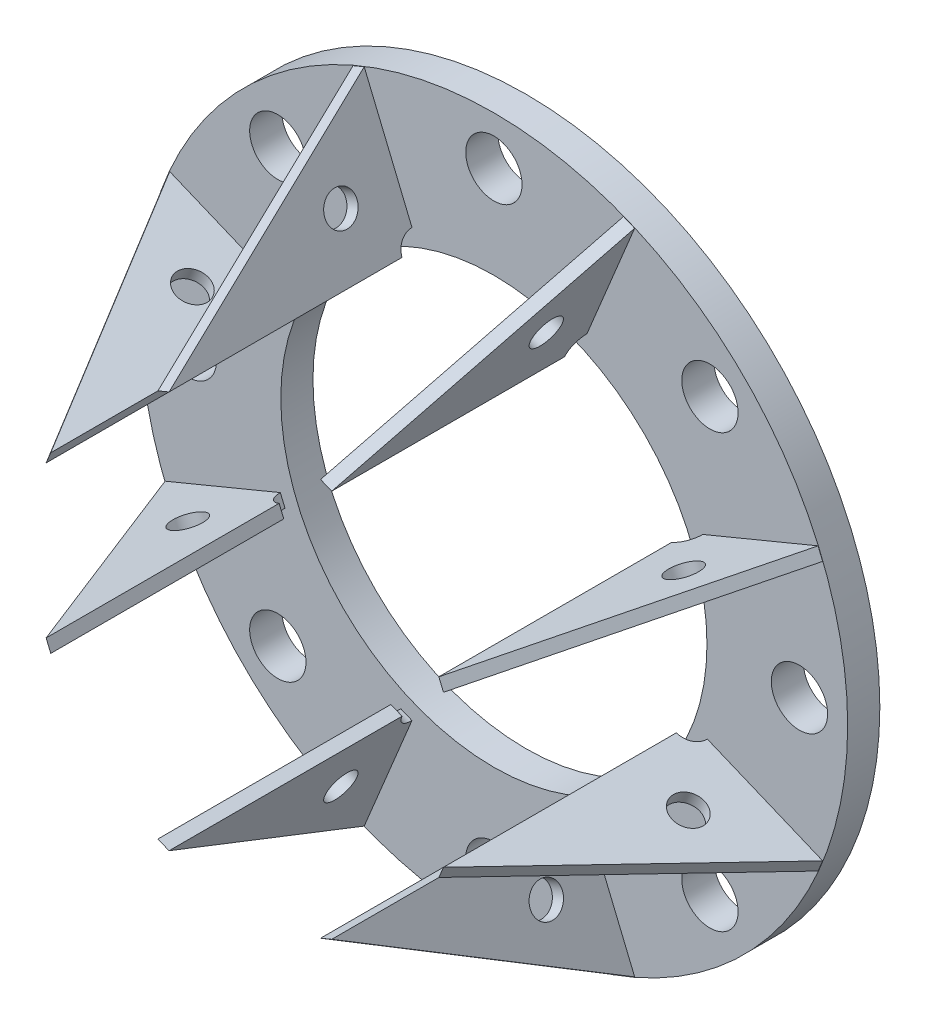
from build123d import *

# Parameters (mm, degrees)
SKETCH1_R         = 139.7
SKETCH1_R_2       = 84.1375
EXTRUDE1_DEPTH    = 12.7
CIRPATTERN2_COUNT = 8
EXTRUDE4_DEPTH    = 98.345625
EXTRUDE5_REACH    = 230.557
SKETCH8_R         = 6.35
CIRPATTERN4_COUNT = 8


with BuildPart() as part:
    # Sketch1 → Extrude1 (new body)
    with BuildSketch(Plane.XY):
        Circle(SKETCH1_R)
        Circle(SKETCH1_R_2, mode=Mode.SUBTRACT)
    extrude(amount=EXTRUDE1_DEPTH)

    # Sketch2 → 0.625_ Diameter Hole1 (revolve, cut)
    with BuildSketch(Plane(origin=(0, 120.65, 12.7), x_dir=(0, -1, 0), z_dir=(1, 0, 0))):
        Polygon((0, 0), (0, 32.077063629), (11.1125, 25.4), (11.1125, 0), align=None)
    f_0_625_diameter_hole1 = revolve(axis=Axis((0, 120.65, 19.05), (0, 0, -1)), mode=Mode.SUBTRACT)

    # CirPattern2: 0.625_ Diameter Hole1 ×8 about axis
    cirpattern2_axis = Axis((0, 0, 12.7), (0, 0, -1))
    for i in range(1, CIRPATTERN2_COUNT):
        add(f_0_625_diameter_hole1.rotate(cirpattern2_axis, i * 360 / CIRPATTERN2_COUNT), mode=Mode.SUBTRACT)

    # Sketch6 → Extrude4 (add)
    with BuildSketch(Plane.XY.offset(12.7)):
        Polygon((-55.596678696, 127.999749611), (-34.313207501, 76.616904797), (-29.913231227, 78.439434644), (-51.196702422, 129.822279457), align=None)
    extrude4 = extrude(amount=EXTRUDE4_DEPTH)

    # Sketch8 → Extrude5 (cut, up to next)
    with BuildSketch(Plane(origin=(2.199988137, 0.911264923, 0), x_dir=(0, 0, -1), z_dir=(0.9238795325112866, 0.3826834323650903, 0)), mode=Mode.PRIVATE) as extrude5_sk1:
        with Locations((-34.755447715, 105.971333923)):
            Circle(SKETCH8_R)
    extrude5_tool1 = extrude(extrude5_sk1.sketch, amount=-EXTRUDE5_REACH, mode=Mode.PRIVATE) & part.part
    # Sketch8 → Extrude5 (cut, up to next)
    with BuildSketch(Plane(origin=(2.199988137, 0.911264923, 0), x_dir=(0, 0, -1), z_dir=(0.9238795325112866, 0.3826834323650903, 0)), mode=Mode.PRIVATE) as extrude5_sk2:
        Polygon((-12.7, 139.532276663), (-111.045625, 83.915886208), (-111.045625, 139.532276663), align=None)
    extrude5_tool2 = extrude(extrude5_sk2.sketch, amount=-EXTRUDE5_REACH, mode=Mode.PRIVATE) & part.part
    # Sketch8 → Extrude5 (cut, up to next)
    with BuildSketch(Plane(origin=(2.199988137, 0.911264923, 0), x_dir=(0, 0, -1), z_dir=(0.9238795325112866, 0.3826834323650903, 0)), mode=Mode.PRIVATE) as extrude5_sk3:
        with BuildLine():
            Line((-12.7, 90.265886208), (-12.7, 83.915886208))
            Line((-12.7, 83.915886208), (-19.05, 83.915886208))
            ThreePointArc((-19.05, 83.915886208), (-17.190128061, 88.406014269), (-12.7, 90.265886208))
        make_face()
    extrude5_tool3 = extrude(extrude5_sk3.sketch, amount=-EXTRUDE5_REACH, mode=Mode.PRIVATE) & part.part
    extrude5_1 = extrude5_tool1.solids().sort_by_distance((-38.353486, 98.816011, 34.755448))[0]
    add(extrude5_1, mode=Mode.SUBTRACT)
    extrude5_2 = extrude5_tool2.solids().sort_by_distance((-44.102212, 112.694665, 78.26375))[0]
    add(extrude5_2, mode=Mode.SUBTRACT)
    extrude5_3 = extrude5_tool3.solids().sort_by_distance((-30.944572, 80.929312, 15.395024))[0]
    add(extrude5_3, mode=Mode.SUBTRACT)
    extrude5 = extrude5_1 + extrude5_2 + extrude5_3  # Extrude5 as one shape, for the pattern or mirror that repeats it

    # CirPattern4: Extrude4, Extrude5 ×8 about axis
    cirpattern4_axis = Axis((0, 0, 12.7), (0, 0, -1))
    add([extrude4.rotate(cirpattern4_axis, i * 360 / CIRPATTERN4_COUNT) for i in range(1, CIRPATTERN4_COUNT)])
    add([extrude5.rotate(cirpattern4_axis, i * 360 / CIRPATTERN4_COUNT) for i in range(1, CIRPATTERN4_COUNT)], mode=Mode.SUBTRACT)


solid = part.part
